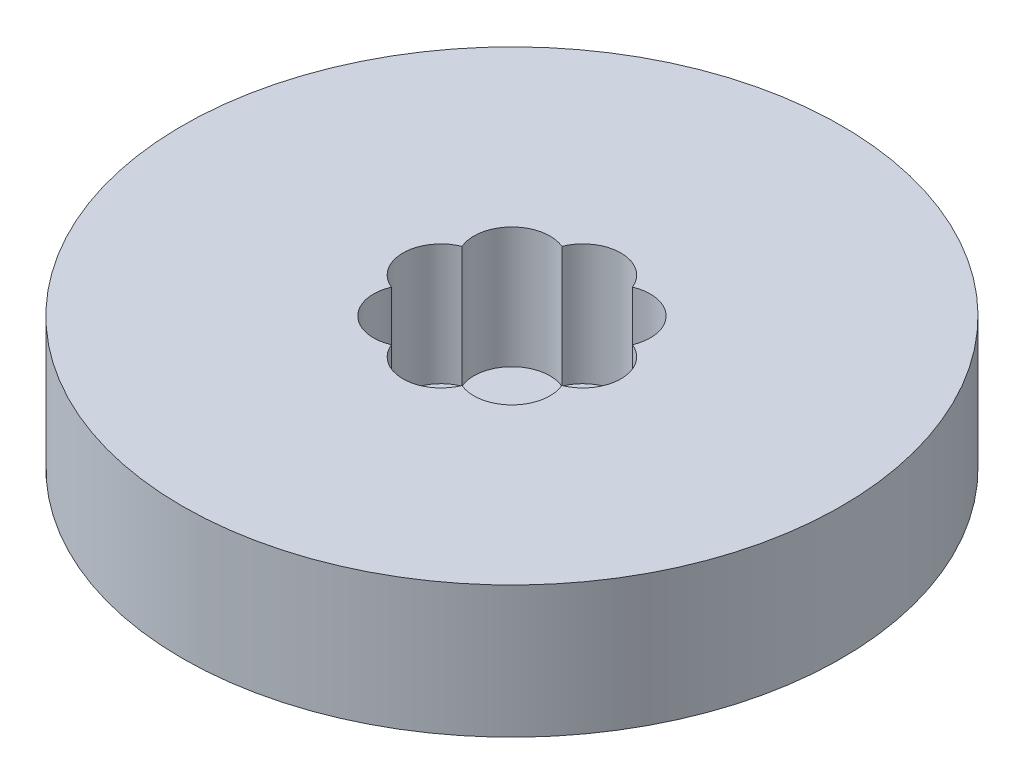
from build123d import *

# Parameters (mm, degrees)
SKETCH1_R           = 27.5
BOSS_EXTRUDE1_DEPTH = 11
SKETCH2_R           = 5
CUT_EXTRUDE1_DEPTH  = 41.416580756
SKETCH3_R           = 3.176711529
CUT_EXTRUDE2_DEPTH  = 10.102814625
CIRPATTERN1_COUNT   = 8


with BuildPart() as part:
    # Sketch1 → Boss-Extrude1 (new body)
    with BuildSketch(Plane(origin=(0, 0, 0), x_dir=(1, 0, 0), z_dir=(0, 1, 0))):
        Circle(SKETCH1_R)
    extrude(amount=BOSS_EXTRUDE1_DEPTH)

    # Sketch2 → Cut-Extrude1 (cut, through all)
    with BuildSketch(Plane(origin=(0, 0, 0), x_dir=(1, 0, 0), z_dir=(0, 1, 0))):
        Circle(SKETCH2_R)
    extrude(amount=CUT_EXTRUDE1_DEPTH, mode=Mode.SUBTRACT)

    # Sketch3 → Cut-Extrude2 (cut)
    with BuildSketch(Plane(origin=(0, 11, 0), x_dir=(1, 0, 0), z_dir=(0, 1, 0))):
        with Locations((-5.920961164, 0)):
            Circle(SKETCH3_R)
    cut_extrude2 = extrude(amount=-CUT_EXTRUDE2_DEPTH, mode=Mode.SUBTRACT)

    # CirPattern1: Cut-Extrude2 ×8 about axis
    cirpattern1_axis = Axis((0, 0, 0), (0, 1, 0))
    for i in range(1, CIRPATTERN1_COUNT):
        add(cut_extrude2.rotate(cirpattern1_axis, i * 360 / CIRPATTERN1_COUNT), mode=Mode.SUBTRACT)


solid = part.part
